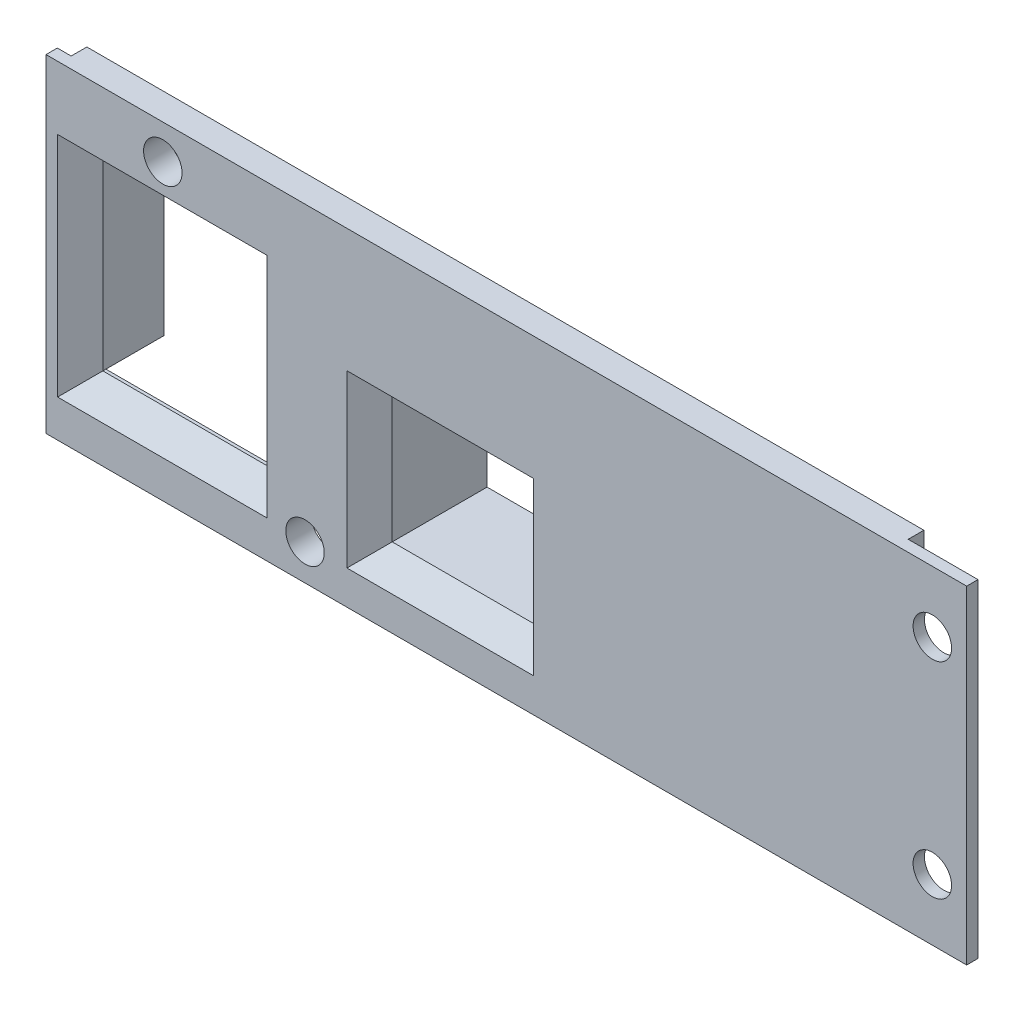
from build123d import *

# Parameters (mm, degrees)
SKIZZE1_W                       = 81.364988045
SKIZZE1_H                       = 29
AUFSATZ_LINEAR_AUSTRAGEN1_DEPTH = 1
SKIZZE2_W                       = 73.970901255
SKIZZE2_H                       = 27.9
AUFSATZ_LINEAR_AUSTRAGEN2_DEPTH = 1.385451
SKIZZE3_W                       = 17.9
SKIZZE3_H                       = 11.549624398
AUFSATZ_LINEAR_AUSTRAGEN3_DEPTH = 11.894549
SKIZZE4_W                       = 14.5
SKIZZE4_H                       = 16.1
SCHNITT_LINEAR_AUSTRAGEN1_DEPTH = 8
AUFSATZ_LINEAR_AUSTRAGEN4_DEPTH = 5
SKIZZE6_W                       = 12.5
SKIZZE6_H                       = 11.1
SCHNITT_LINEAR_AUSTRAGEN2_DEPTH = 88.193701467
AUFSATZ_LINEAR_AUSTRAGEN5_DEPTH = 8
FASE2_SIZE                      = 2
SKIZZE8_R                       = 1.7
SCHNITT_LINEAR_AUSTRAGEN3_DEPTH = 12
SCHNITT_LINEAR_AUSTRAGEN5_DEPTH = 0.114549
SKIZZE11_R                      = 1.7
SCHNITT_LINEAR_AUSTRAGEN6_DEPTH = 12
FASE3_SIZE                      = 3
SKIZZE12_R                      = 1.7
SCHNITT_LINEAR_AUSTRAGEN7_DEPTH = 88.193701467


with BuildPart() as part:
    # Skizze1 → Aufsatz-Linear austragen1 (new body)
    with BuildSketch(Plane.XY):
        with Locations((40.682494023, 14.5)):
            Rectangle(SKIZZE1_W, SKIZZE1_H)
    extrude(amount=AUFSATZ_LINEAR_AUSTRAGEN1_DEPTH)

    # Skizze2 → Aufsatz-Linear austragen2 (add)
    with BuildSketch(Plane(origin=(0, 0, 0), x_dir=(-1, 0, 0), z_dir=(0, 0, -1))):
        with Locations((-38.210114258, 15.05)):
            Rectangle(SKIZZE2_W, SKIZZE2_H)
    extrude(amount=AUFSATZ_LINEAR_AUSTRAGEN2_DEPTH)

    # Skizze3 → Aufsatz-Linear austragen3 (add)
    with BuildSketch(Plane(origin=(0, 0, -1.385450769), x_dir=(-1, 0, 0), z_dir=(0, 0, -1))):
        with Locations((-50.045564885, 10.474812199)):
            Rectangle(SKIZZE3_W, SKIZZE3_H)
    extrude(amount=AUFSATZ_LINEAR_AUSTRAGEN3_DEPTH)

    # Skizze4 → Schnitt-Linear austragen1 (cut)
    with BuildSketch(Plane(origin=(0, 0, -1.385450769), x_dir=(-1, 0, 0), z_dir=(0, 0, -1))):
        with Locations((-10.27466363, 13.35)):
            Rectangle(SKIZZE4_W, SKIZZE4_H)
    extrude(amount=-SCHNITT_LINEAR_AUSTRAGEN1_DEPTH, mode=Mode.SUBTRACT)

    # Skizze5 → Aufsatz-Linear austragen4 (add)
    with BuildSketch(Plane(origin=(0, 0, -1.385450769), x_dir=(-1, 0, 0), z_dir=(0, 0, -1))):
        Polygon((-19.02466363, 22.9), (-19.02466363, 5.3), (-17.52466363, 5.3), (-17.52466363, 21.4), (-3.02466363, 21.4), (-3.02466363, 5.3), (-1.22466363, 5.3), (-1.22466363, 22.9), align=None)
    extrude(amount=AUFSATZ_LINEAR_AUSTRAGEN4_DEPTH)

    # Skizze6 → Schnitt-Linear austragen2 (cut, through all)
    with BuildSketch(Plane(origin=(0, 0, -1.385450769), x_dir=(-1, 0, 0), z_dir=(0, 0, -1))):
        with Locations((-34.845564885, 10.55)):
            Rectangle(SKIZZE6_W, SKIZZE6_H)
    extrude(amount=-SCHNITT_LINEAR_AUSTRAGEN2_DEPTH, mode=Mode.SUBTRACT)

    # Skizze7 → Aufsatz-Linear austragen5 (add)
    with BuildSketch(Plane(origin=(0, 0, -1.385450769), x_dir=(-1, 0, 0), z_dir=(0, 0, -1))):
        Polygon((-28.595564885, 5), (-28.595564885, 16.249624398), (-26.595564885, 16.249624398), (-26.595564885, 3), (-43.095564885, 3), (-43.095564885, 16.249624398), (-41.095564885, 16.249624398), (-41.095564885, 5), align=None)
    extrude(amount=AUFSATZ_LINEAR_AUSTRAGEN5_DEPTH)

    # Fase2
    fase2_edges = [part.edges().sort_by_distance(p)[0] for p in [
        (10.27466363, 5.3, 1),
        (3.02466363, 13.35, 1),
        (10.27466363, 21.4, 1),
        (17.52466363, 13.35, 1),
        (28.595564885, 10.55, 1),
        (34.845564885, 5, 1),
        (41.095564885, 10.55, 1),
        (34.845564885, 16.1, 1),
    ]]
    chamfer(fase2_edges, length=FASE2_SIZE)

    # Skizze8 → Schnitt-Linear austragen3 (cut)
    with BuildSketch(Plane(origin=(0, 0, 0), x_dir=(-1, 0, 0), z_dir=(0, 0, -1))):
        with Locations((-78.330276465, 23.584796683)):
            Circle(SKIZZE8_R)
        with Locations((-78.330276465, 5.415203317)):
            Circle(SKIZZE8_R)
    extrude(amount=-SCHNITT_LINEAR_AUSTRAGEN3_DEPTH, mode=Mode.SUBTRACT)

    # Skizze10 → Schnitt-Linear austragen5 (cut)
    with BuildSketch(Plane(origin=(0, 0, -1.385450769), x_dir=(-1, 0, 0), z_dir=(0, 0, -1))):
        Polygon((-1.12466363, 5.3), (-26.595564885, 5.3), (-26.595564885, 1.1), (-1.22466363, 1.1), align=None)
    extrude(amount=-SCHNITT_LINEAR_AUSTRAGEN5_DEPTH, mode=Mode.SUBTRACT)

    # Skizze11 → Schnitt-Linear austragen6 (cut)
    with BuildSketch(Plane(origin=(0, 0, -1.270901539), x_dir=(-1, 0, 0), z_dir=(0, 0, -1))):
        with Locations((-22.891035352, 3.15)):
            Circle(SKIZZE11_R)
    extrude(amount=-SCHNITT_LINEAR_AUSTRAGEN6_DEPTH, mode=Mode.SUBTRACT)

    # Fase3
    # the kernel refuses this chamfer: 3 mm, written as the material it takes off along each edge
    with BuildSketch(Plane(origin=(26.595564885, 3, -1.385450769), x_dir=(0.9996219148284762, 0, -0.02749595233212696), z_dir=(0, -1, 0))) as fase3_piece_1_section:
        Polygon((FASE3_SIZE * 0.999621916941, FASE3_SIZE * 0.027495875526), (-FASE3_SIZE * 0.0274959523321, FASE3_SIZE * 0.999621914828), (0, 0), align=None)
    fase3_piece_1 = extrude(amount=9.615048972, mode=Mode.PRIVATE)
    fase3_piece_1 = split(fase3_piece_1, bisect_by=Plane(origin=(29.23101577, 2.05, -1.270901769), z_dir=(0, 0, -1)), keep=Keep.TOP, mode=Mode.PRIVATE)
    add(fase3_piece_1, mode=Mode.SUBTRACT)

    # Skizze12 → Schnitt-Linear austragen7 (cut, through all)
    with BuildSketch(Plane(origin=(0, 0, -1.385450769), x_dir=(-1, 0, 0), z_dir=(0, 0, -1))):
        with Locations((-10.32466363, 25.95)):
            Circle(SKIZZE12_R)
    extrude(amount=-SCHNITT_LINEAR_AUSTRAGEN7_DEPTH, mode=Mode.SUBTRACT)


solid = part.part
